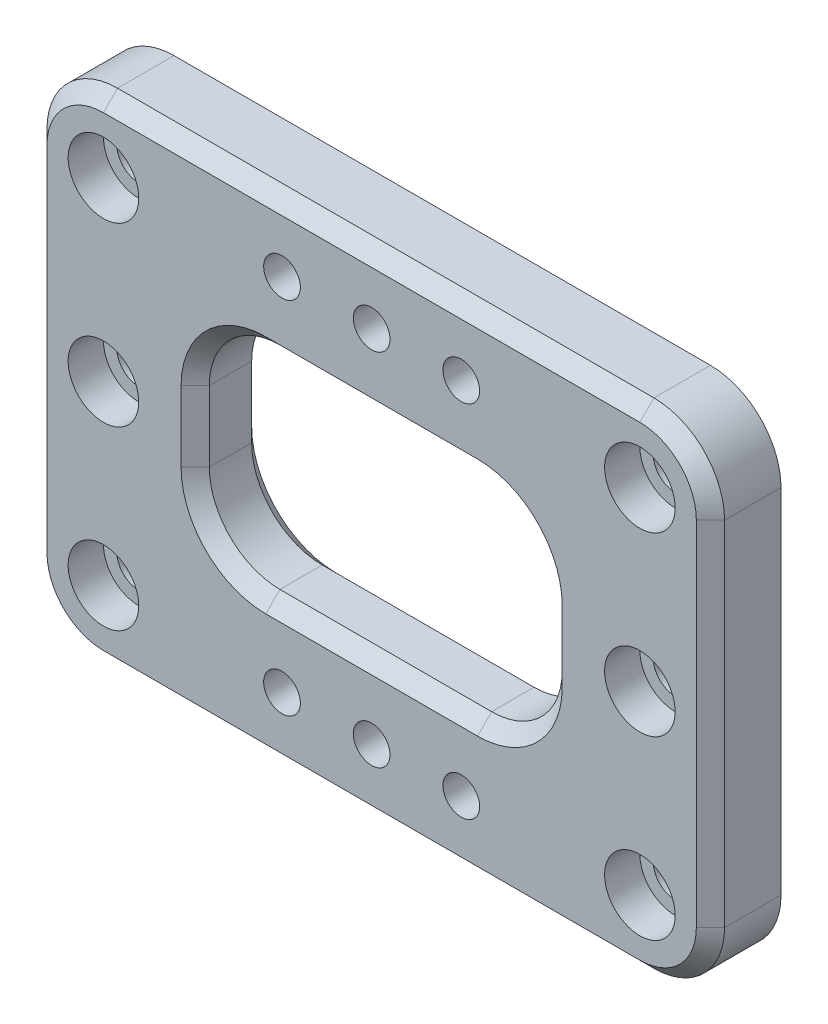
from build123d import *

# Parameters (mm, degrees)
SKETCH_1_W          = 96
SKETCH_1_H          = 70
EXTRUDE_1_DEPTH     = 10
FILLET_1_R          = 10
SKETCH_2_R          = 2.6
CUT_EXTRUDE_1_DEPTH = 10
SKETCH_3_R          = 5
CUT_EXTRUDE_2_DEPTH = 5
SKETCH_4_R          = 3.1
CUT_EXTRUDE_3_DEPTH = 5
CHAMFER_1_SIZE      = 1
CHAMFER_2_SIZE      = 2
SKETCH_5_W          = 50
SKETCH_5_H          = 30
CUT_EXTRUDE_4_DEPTH = 10
FILLET_2_R          = 10
CHAMFER_3_SIZE      = 2


with BuildPart() as part:
    # 草图1 → 凸台-拉伸1 (new body)
    with BuildSketch(Plane.XY):
        Rectangle(SKETCH_1_W, SKETCH_1_H)
    extrude(amount=EXTRUDE_1_DEPTH)

    # 圆角1
    fillet_1_edges = [part.edges().sort_by_distance(p)[0] for p in [
        (48, -35, 5),
        (-48, -35, 5),
        (48, 35, 5),
        (-48, 35, 5),
    ]]
    fillet(fillet_1_edges, radius=FILLET_1_R)

    # 草图2 → 切除-拉伸1 (cut)
    with BuildSketch(Plane.XY.offset(10)):
        with Locations((0, 25.5)):
            Circle(SKETCH_2_R)
        with Locations((-12.7, 25.5)):
            Circle(SKETCH_2_R)
        with Locations((12.7, 25.5)):
            Circle(SKETCH_2_R)
        with Locations((-12.7, -25.5)):
            Circle(SKETCH_2_R)
        with Locations((0, -25.5)):
            Circle(SKETCH_2_R)
        with Locations((12.7, -25.5)):
            Circle(SKETCH_2_R)
    extrude(amount=-CUT_EXTRUDE_1_DEPTH, mode=Mode.SUBTRACT)

    # 草图3 → 切除-拉伸2 (cut)
    with BuildSketch(Plane.XY.offset(10)):
        with Locations((-38, 25)):
            Circle(SKETCH_3_R)
        with Locations((-38, 0)):
            Circle(SKETCH_3_R)
        with Locations((-38, -25)):
            Circle(SKETCH_3_R)
        with Locations((38, -25)):
            Circle(SKETCH_3_R)
        with Locations((38, 0)):
            Circle(SKETCH_3_R)
        with Locations((38, 25)):
            Circle(SKETCH_3_R)
    extrude(amount=-CUT_EXTRUDE_2_DEPTH, mode=Mode.SUBTRACT)

    # 草图4 → 切除-拉伸3 (cut)
    with BuildSketch(Plane.XY.offset(5)):
        with Locations((-38, 25)):
            Circle(SKETCH_4_R)
        with Locations((-38, 0)):
            Circle(SKETCH_4_R)
        with Locations((-38, -25)):
            Circle(SKETCH_4_R)
        with Locations((38, 25)):
            Circle(SKETCH_4_R)
        with Locations((38, 0)):
            Circle(SKETCH_4_R)
        with Locations((38, -25)):
            Circle(SKETCH_4_R)
    extrude(amount=-CUT_EXTRUDE_3_DEPTH, mode=Mode.SUBTRACT)

    # 倒角1
    chamfer_1_edges = [part.edges().sort_by_distance(p)[0] for p in [
        (34.9, 25, 0),
        (34.9, 0, 0),
        (34.9, -25, 0),
        (-41.1, -25, 0),
        (-41.1, 0, 0),
        (-41.1, 25, 0),
    ]]
    chamfer(chamfer_1_edges, length=CHAMFER_1_SIZE)

    # 倒角2
    chamfer_2_edges = [part.edges().sort_by_distance(p)[0] for p in [
        (48, 0, 10),
        (45.071067812, 32.071067812, 10),
        (45.071067812, -32.071067812, 10),
        (0, 35, 10),
        (0, -35, 10),
        (-45.071067812, 32.071067812, 10),
        (-45.071067812, -32.071067812, 10),
        (-48, 0, 10),
    ]]
    chamfer(chamfer_2_edges, length=CHAMFER_2_SIZE)

    # 草图5 → 切除-拉伸4 (cut)
    with BuildSketch(Plane.XY.offset(10)):
        Rectangle(SKETCH_5_W, SKETCH_5_H)
    extrude(amount=-CUT_EXTRUDE_4_DEPTH, mode=Mode.SUBTRACT)

    # 圆角2
    fillet_2_edges = [part.edges().sort_by_distance(p)[0] for p in [
        (25, -15, 5),
        (25, 15, 5),
        (-25, -15, 5),
        (-25, 15, 5),
    ]]
    fillet(fillet_2_edges, radius=FILLET_2_R)

    # 倒角3
    chamfer_3_edges = [part.edges().sort_by_distance(p)[0] for p in [
        (22.071067812, -12.071067812, 0),
        (22.071067812, 12.071067812, 0),
        (0, -15, 0),
        (0, 15, 0),
        (-22.071067812, -12.071067812, 0),
        (-22.071067812, 12.071067812, 0),
        (22.071067812, -12.071067812, 10),
        (0, -15, 10),
        (22.071067812, 12.071067812, 10),
        (-22.071067812, -12.071067812, 10),
        (0, 15, 10),
        (-22.071067812, 12.071067812, 10),
        (25, 0, 0),
        (-25, 0, 0),
        (25, 0, 10),
        (-25, 0, 10),
    ]]
    chamfer(chamfer_3_edges, length=CHAMFER_3_SIZE)


solid = part.part
